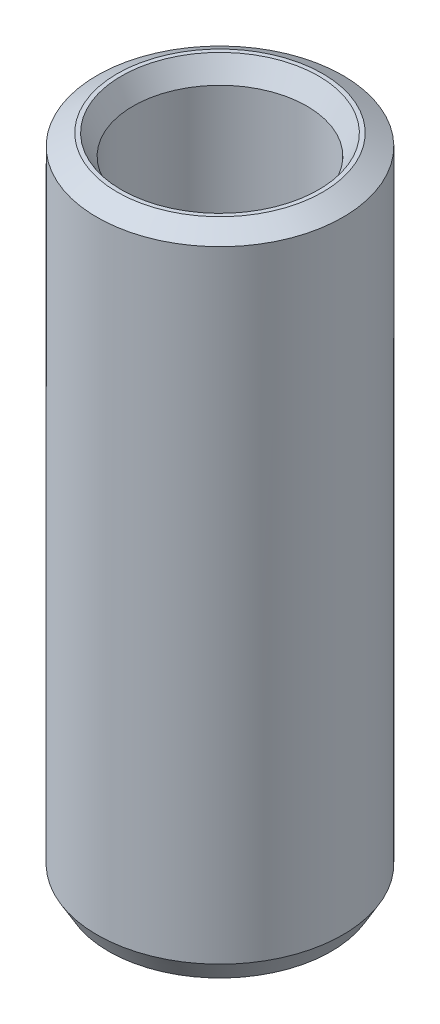
from build123d import *
from OCP.BRepFilletAPI import BRepFilletAPI_MakeChamfer

# Parameters (mm, degrees)
SKETCH1_R           = 30
BOSS_EXTRUDE1_DEPTH = 159.432788918
SKETCH2_R           = 21.214400563
CUT_EXTRUDE1_DEPTH  = 165.981254033
CHAMFER1_SIZE       = 2.84865529
CHAMFER1_SIZE2      = 4.934015696


with BuildPart() as part:
    # Sketch1 → Boss-Extrude1 (new body)
    with BuildSketch(Plane(origin=(0, 0, 0), x_dir=(1, 0, 0), z_dir=(0, 1, 0))):
        Circle(SKETCH1_R)
    extrude(amount=BOSS_EXTRUDE1_DEPTH)

    # Sketch2 → Cut-Extrude1 (cut, through all)
    with BuildSketch(Plane(origin=(0, 0, 0), x_dir=(1, 0, 0), z_dir=(0, 1, 0))):
        Circle(SKETCH2_R)
    extrude(amount=CUT_EXTRUDE1_DEPTH, mode=Mode.SUBTRACT)

    # Chamfer1: one chamfer whose edges measure the first distance from different faces: ONE call of the kernel's chamfer builder (chamfer() names one face for all edges)
    chamfer1_edges_1 = [part.edges().sort_by_distance(p)[0] for p in [
        (-21.214400563, 159.432788918, 0),
    ]]
    chamfer1_side_1 = [part.faces().sort_by_distance(p)[0] for p in [
        (-29.151471863, 159.432788918, 0),
    ]]
    chamfer1_edges_2 = [part.edges().sort_by_distance(p)[0] for p in [
        (-21.214400563, 0, 0),
    ]]
    chamfer1_side_2 = [part.faces().sort_by_distance(p)[0] for p in [
        (-21.214400563, 79.716394459, 0),
    ]]
    chamfer1_edges_3 = [part.edges().sort_by_distance(p)[0] for p in [
        (-30, 0, 0),
    ]]
    chamfer1_side_3 = [part.faces().sort_by_distance(p)[0] for p in [
        (-29.151471863, 0, 0),
    ]]
    chamfer1_edges_4 = [part.edges().sort_by_distance(p)[0] for p in [
        (-30, 159.432788918, 0),
    ]]
    chamfer1_side_4 = [part.faces().sort_by_distance(p)[0] for p in [
        (-30, 79.716394459, 0),
    ]]
    chamfer1 = BRepFilletAPI_MakeChamfer(part.part.solid().wrapped)
    for e in chamfer1_edges_1:
        chamfer1.Add(CHAMFER1_SIZE, CHAMFER1_SIZE2, e.wrapped, chamfer1_side_1[0].wrapped)  # the first distance lies on this face
    for e in chamfer1_edges_2:
        chamfer1.Add(CHAMFER1_SIZE, CHAMFER1_SIZE2, e.wrapped, chamfer1_side_2[0].wrapped)  # the first distance lies on this face
    for e in chamfer1_edges_3:
        chamfer1.Add(CHAMFER1_SIZE, CHAMFER1_SIZE2, e.wrapped, chamfer1_side_3[0].wrapped)  # the first distance lies on this face
    for e in chamfer1_edges_4:
        chamfer1.Add(CHAMFER1_SIZE, CHAMFER1_SIZE2, e.wrapped, chamfer1_side_4[0].wrapped)  # the first distance lies on this face
    add(Compound.cast(chamfer1.Shape()), mode=Mode.REPLACE)


solid = part.part
